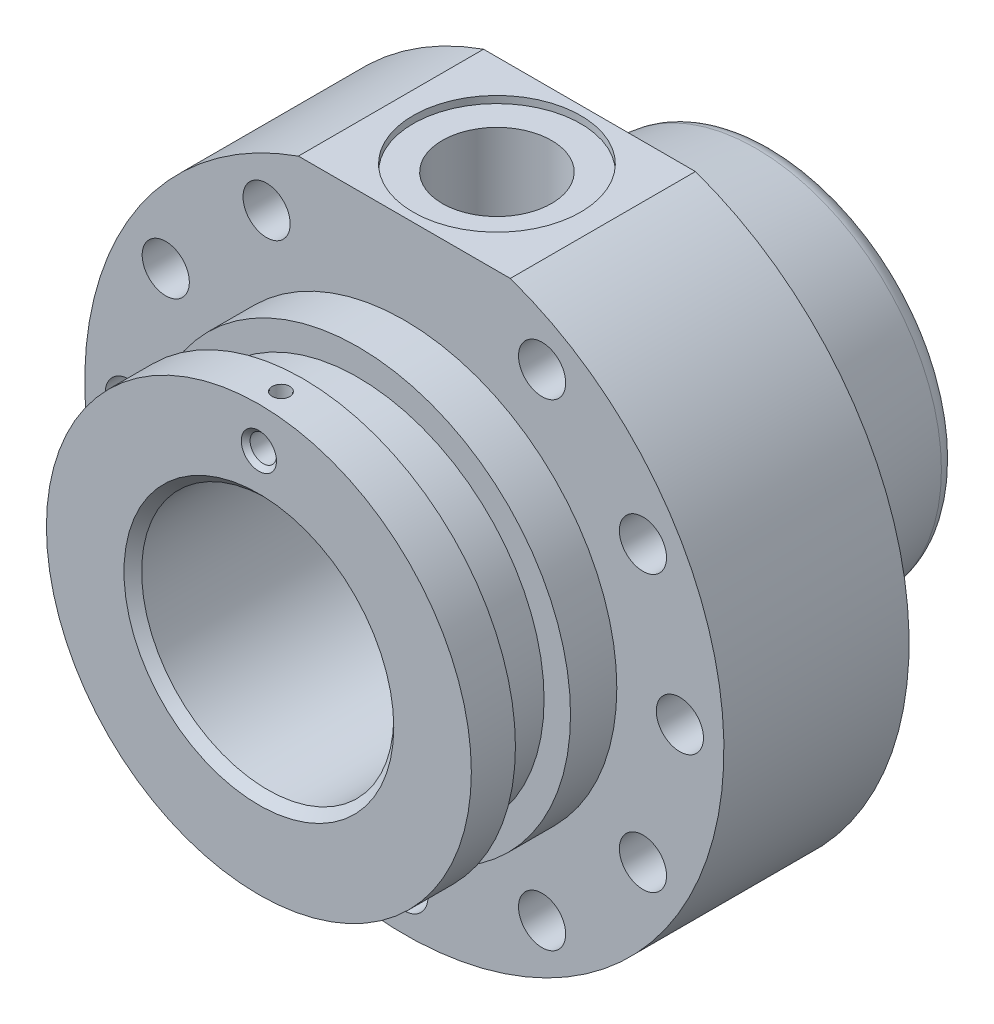
from build123d import *

# Parameters (mm, degrees)
SKETCH1_R                      = 72.5
BOSS_EXTRUDE1_DEPTH            = 42
SKETCH2_R                      = 48.2
BOSS_EXTRUDE2_DEPTH            = 33
SKETCH4_R                      = 28.6
CUT_EXTRUDE1_DEPTH             = 156.568312969
SKETCH5_R                      = 35
CUT_EXTRUDE2_DEPTH             = 8
SKETCH6_W                      = 12.5
SKETCH6_H                      = 6
FILLET1_R                      = 5
SKETCH7_R                      = 5.35
CUT_EXTRUDE3_DEPTH             = 156.568312969
CIRPATTERN1_COUNT              = 12
CHAMFER1_SIZE                  = 2
CUT_EXTRUDE4_DEPTH             = 177.599830124
CUT_EXTRUDE4_DEPTH_BACK        = 1.6
SKETCH8_W                      = 51
SKETCH8_H                      = 63
BOSS_EXTRUDE3_START            = -42
SKETCH10_R                     = 5.35
BOSS_EXTRUDE3_DEPTH            = 42
SKETCH9_R                      = 19
CUT_EXTRUDE5_DEPTH             = 1.6
SKETCH11_R                     = 12.4
CUT_EXTRUDE6_DEPTH             = 23
CUT_EXTRUDE7_REACH             = 158.227
CUT_EXTRUDE7_END_RADIUS        = 28.6
SKETCH12_R                     = 7.5
CUT_EXTRUDE7_DIRECTION_2_DEPTH = 157.227206337
CUT_EXTRUDE8_REACH             = 157.568
CUT_EXTRUDE8_END_RADIUS        = 7.5
SKETCH13_R                     = 3
CHAMFER2_SIZE                  = 1
CUT_EXTRUDE11_START            = 41.236068177
CUT_EXTRUDE11_DEPTH            = 6.963931924


# Read off the part's stored shape, not the designer's step: Cut-Extrude11
with BuildPart() as part:
    # Sketch1 → Boss-Extrude1 (new body)
    with BuildSketch(Plane.XY):
        with Locations(Location((0, 0, 0), (0, 0, 180))):
            Circle(SKETCH1_R)
    extrude(amount=BOSS_EXTRUDE1_DEPTH)

    # Sketch2 → Boss-Extrude2 (add)
    with BuildSketch(Plane.XY.offset(42)):
        Circle(SKETCH2_R)
    extrude(amount=BOSS_EXTRUDE2_DEPTH)

    # Sketch3 → Revolve1 (revolve)
    with BuildSketch(Plane(origin=(0, 0, 0), x_dir=(0, 0, -1), z_dir=(1, 0, 0)), mode=Mode.PRIVATE) as revolve1_sk:
        Polygon((0, 47.6), (42, 41.5), (42, 28.6), (0, 28.6), align=None)
    revolve(revolve1_sk.sketch.rotate(Axis((0, 0, 0), (0, 0, -1)), 90), axis=Axis((0, 0, 0), (0, 0, -1)))

    # Sketch4 → Cut-Extrude1 (cut, through all)
    with BuildSketch(Plane.XY.offset(75)):
        Circle(SKETCH4_R)
    extrude(amount=-CUT_EXTRUDE1_DEPTH, mode=Mode.SUBTRACT)

    # Sketch5 → Cut-Extrude2 (cut)
    with BuildSketch(Plane(origin=(0, 0, -42), x_dir=(-1, 0, 0), z_dir=(0, 0, -1))):
        Circle(SKETCH5_R)
    extrude(amount=-CUT_EXTRUDE2_DEPTH, mode=Mode.SUBTRACT)

    # Sketch6 → Cut-Revolve1 (revolve, cut)
    with BuildSketch(Plane(origin=(0, 0, 0), x_dir=(0, 0, -1), z_dir=(1, 0, 0)), mode=Mode.PRIVATE) as cut_revolve1_sk:
        with Locations((-58.75, 45.2)):
            Rectangle(SKETCH6_W, SKETCH6_H)
    revolve(cut_revolve1_sk.sketch.rotate(Axis((0, 0, 75), (0, 0, -1)), 90), axis=Axis((0, 0, 75), (0, 0, -1)), mode=Mode.SUBTRACT)

    # Fillet1
    fillet1_edges = [part.edges().sort_by_distance(p)[0] for p in [
        (-41.5, 0, -42),
    ]]
    fillet(fillet1_edges, radius=FILLET1_R)

    # Sketch7 → Cut-Extrude3 (cut, through all)
    with BuildSketch(Plane.XY.offset(75)):
        with Locations((0, 62.5)):
            Circle(SKETCH7_R)
    cut_extrude3 = extrude(amount=-CUT_EXTRUDE3_DEPTH, mode=Mode.SUBTRACT)

    # CirPattern1: Cut-Extrude3 ×12 about axis
    cirpattern1_axis = Axis((0, 0, 0), (0, 0, 1))
    for i in range(1, CIRPATTERN1_COUNT):
        add(cut_extrude3.rotate(cirpattern1_axis, i * 360 / CIRPATTERN1_COUNT), mode=Mode.SUBTRACT)

    # Chamfer1
    chamfer1_edges = [part.edges().sort_by_distance(p)[0] for p in [
        (-28.6, 0, 75),
    ]]
    chamfer(chamfer1_edges, length=CHAMFER1_SIZE)

    # Sketch8 → Cut-Extrude4 (cut, two sides: drawn at the far end of the back side and taken through both)
    with BuildSketch(Plane(origin=(0, 70, 0), x_dir=(1, 0, 0), z_dir=(0, 1, 0)).offset(-CUT_EXTRUDE4_DEPTH_BACK)):
        with Locations((0, -21)):
            Rectangle(SKETCH8_W, SKETCH8_H)
    extrude(amount=CUT_EXTRUDE4_DEPTH + CUT_EXTRUDE4_DEPTH_BACK, mode=Mode.SUBTRACT)

    # Sketch10 → Boss-Extrude3 (add)
    with BuildSketch(Plane(origin=(0, 0, 0), x_dir=(-1, 0, 0), z_dir=(0, 0, -1)).offset(BOSS_EXTRUDE3_START)):
        with Locations((0, 62.5)):
            Circle(SKETCH10_R)
    extrude(amount=BOSS_EXTRUDE3_DEPTH)

    # Sketch9 → Cut-Extrude5 (cut)
    with BuildSketch(Plane(origin=(0, 68.4, 0), x_dir=(1, 0, 0), z_dir=(0, 1, 0))):
        with Locations(Location((0, -21, 0), (0, 0, 270))):
            Circle(SKETCH9_R)
    extrude(amount=-CUT_EXTRUDE5_DEPTH, mode=Mode.SUBTRACT)

    # Sketch11 → Cut-Extrude6 (cut)
    with BuildSketch(Plane(origin=(0, 66.8, 0), x_dir=(1, 0, 0), z_dir=(0, 1, 0))):
        with Locations(Location((0, -21, 0), (0, 0, 270))):
            Circle(SKETCH11_R)
    extrude(amount=-CUT_EXTRUDE6_DEPTH, mode=Mode.SUBTRACT)

    # Cut-Extrude7: up to this cylinder (the profile starts outside it)
    cut_extrude7_end = Plane(origin=(0, 0, 21), z_dir=(0, 0, 1)) * Cylinder(CUT_EXTRUDE7_END_RADIUS, 374.654, mode=Mode.PRIVATE)
    # Sketch12 → Cut-Extrude7 (cut, up to the surface)
    with BuildSketch(Plane(origin=(0, 43.8, 0), x_dir=(1, 0, 0), z_dir=(0, 1, 0)), mode=Mode.PRIVATE) as cut_extrude7_sk1:
        with Locations(Location((0, -21, 0), (0, 0, 270))):
            Circle(SKETCH12_R)
    cut_extrude7_tool1 = extrude(cut_extrude7_sk1.sketch, amount=-CUT_EXTRUDE7_REACH, mode=Mode.PRIVATE) - cut_extrude7_end
    add(cut_extrude7_tool1.solids().sort_by_distance((0, 43.8, 21))[0], mode=Mode.SUBTRACT)

    # Sketch12 → Cut-Extrude7 direction 2 (cut)
    with BuildSketch(Plane(origin=(0, 43.8, 0), x_dir=(1, 0, 0), z_dir=(0, 1, 0))):
        with Locations(Location((0, -21, 0), (0, 0, 270))):
            Circle(SKETCH12_R)
    extrude(amount=CUT_EXTRUDE7_DIRECTION_2_DEPTH, mode=Mode.SUBTRACT)

    # Cut-Extrude8: up to this cylinder (the profile starts outside it)
    cut_extrude8_end = Plane(origin=(0, 39, 21), z_dir=(0, -1, 0)) * Cylinder(CUT_EXTRUDE8_END_RADIUS, 331.136, mode=Mode.PRIVATE)
    # Sketch13 → Cut-Extrude8 (cut, up to the surface)
    with BuildSketch(Plane.XY.offset(75), mode=Mode.PRIVATE) as cut_extrude8_sk1:
        with Locations((0, 39)):
            Circle(SKETCH13_R)
    cut_extrude8_tool1 = extrude(cut_extrude8_sk1.sketch, amount=-CUT_EXTRUDE8_REACH, mode=Mode.PRIVATE) - cut_extrude8_end
    add(cut_extrude8_tool1.solids().sort_by_distance((0, 39, 75))[0], mode=Mode.SUBTRACT)

    # Chamfer2
    chamfer2_edges = [part.edges().sort_by_distance(p)[0] for p in [
        (-3, 39, 75),
    ]]
    chamfer(chamfer2_edges, length=CHAMFER2_SIZE)

    # Cut-Extrude11 outline → Cut-Extrude11 (cut)
    with BuildSketch(Plane(origin=(0, 0, 0), x_dir=(1, 0, 0), z_dir=(0, 1, 0)).offset(CUT_EXTRUDE11_START)):
        with BuildLine():
            add(Edge.make_bspline(
                [(0, -68), (-0.54702537, -68), (-1.060578619, -68.230628831), (-1.773892363, -68.947000843), (-1.998941239, -69.453645947), (-2.001051196, -70.538574914), (-1.778362753, -71.046998742), (-1.061992496, -71.769449741), (-0.543253329, -71.998843249), (0.534702492, -72.001147611), (1.060100727, -71.770006855), (1.774982575, -71.051748391), (1.999780329, -70.547535826), (2.000219348, -69.454070146), (1.774866101, -68.94836038), (1.061104675, -68.230776319), (0.54702537, -68), (0, -68)],
                knots=[0, 0, 0, 0, 0.125, 0.125, 0.25, 0.25, 0.375, 0.375, 0.5, 0.5, 0.625, 0.625, 0.75, 0.75, 0.875, 0.875, 1, 1, 1, 1], degree=3))
        make_face()
    extrude(amount=CUT_EXTRUDE11_DEPTH, mode=Mode.SUBTRACT)


solid = part.part
